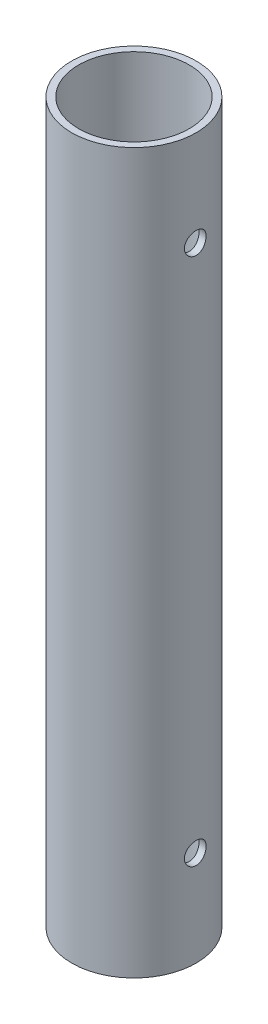
from build123d import *

# Parameters (mm, degrees)
SKETCH1_R           = 14.2875
SKETCH1_R_2         = 12.7
BOSS_EXTRUDE1_DEPTH = 82.55
SKETCH2_R           = 2.4892
CUT_EXTRUDE1_DEPTH  = 85.986868471


with BuildPart() as part:
    # Sketch1 → Boss-Extrude1 (new, symmetric)
    with BuildSketch(Plane(origin=(0, 0, 0), x_dir=(1, 0, 0), z_dir=(0, 1, 0))):
        Circle(SKETCH1_R)
        Circle(SKETCH1_R_2, mode=Mode.SUBTRACT)
    extrude(amount=BOSS_EXTRUDE1_DEPTH, both=True)

    # Sketch2 → Cut-Extrude1 (cut, symmetric)
    with BuildSketch(Plane(origin=(0, 0, 0), x_dir=(0, 0, -1), z_dir=(1, 0, 0))):
        with Locations((0, 60.6425)):
            Circle(SKETCH2_R)
    cut_extrude1 = extrude(amount=CUT_EXTRUDE1_DEPTH, both=True, mode=Mode.SUBTRACT)

    # Mirror1: Cut-Extrude1 across plane
    add(cut_extrude1.mirror(Plane.ZX), mode=Mode.SUBTRACT)


solid = part.part
